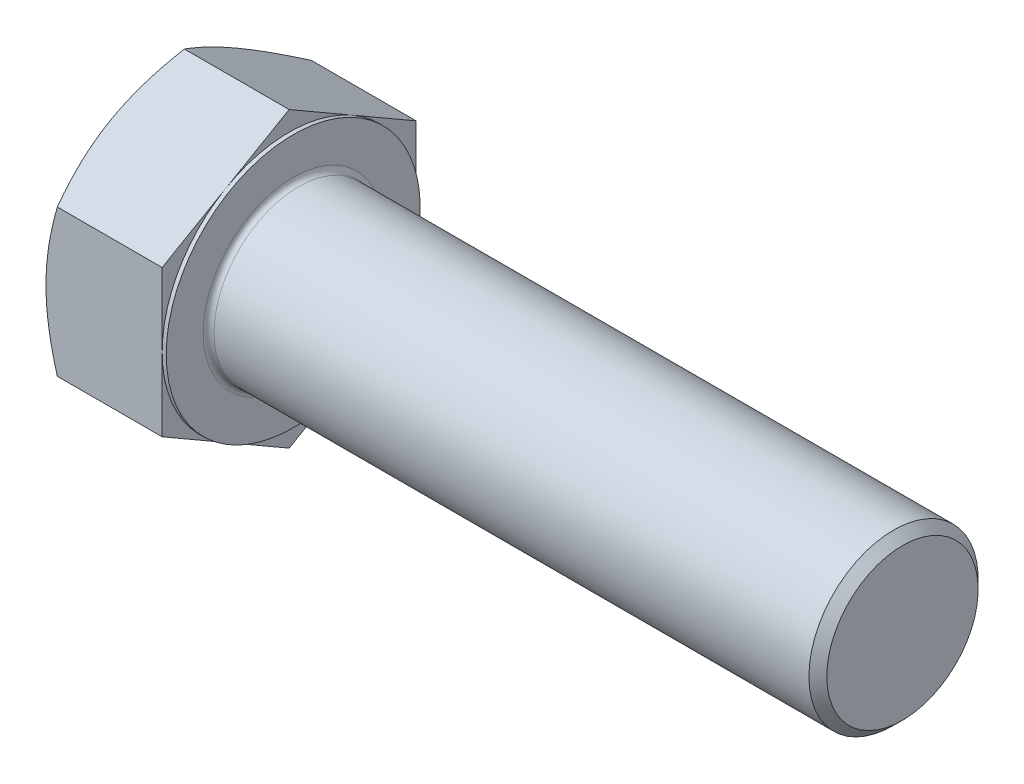
from build123d import *

# Parameters (mm, degrees)
BASEHEAD_DEPTH = 11.2776
SKETCH4_W      = 0.381
SKETCH4_H      = 27.242885633
HEADFILLET_R   = 0.508


with BuildPart() as part:
    # Sketch1 → BaseHead (new body)
    with BuildSketch(Plane(origin=(0, 0, 0), x_dir=(0, 0, -1), z_dir=(1, 0, 0))):
        Polygon((11.9126, 6.877742817), (11.9126, -6.877742817), (0, -13.755485633), (-11.9126, -6.877742817), (-11.9126, 6.877742817), (0, 13.755485633), align=None)
    extrude(amount=BASEHEAD_DEPTH)

    # BodySke → BaseBody (revolve)
    with BuildSketch(Plane.XY):
        Polygon((0, 0), (68.4276, 0), (68.4276, 7.09803), (67.58813, 7.9375), (0, 7.9375), align=None)
    revolve(axis=Axis((0, 0, 0), (1, 0, 0)))

    # Sketch3 → HeadChamfer (revolve, cut)
    with BuildSketch(Plane.XY):
        Polygon((0, 11.9126), (4.730164726, 20.105485633), (4.730164726, 26.455485633), (-12.7, 26.455485633), (-12.7, 11.9126), align=None)
    revolve(axis=Axis((0, 0, 0), (1, 0, 0)), mode=Mode.SUBTRACT)

    # Sketch4 → BearingFace (revolve, cut)
    with BuildSketch(Plane.XY):
        with Locations((11.0871, 25.534042817)):
            Rectangle(SKETCH4_W, SKETCH4_H)
    revolve(axis=Axis((0, 0, 0), (1, 0, 0)), mode=Mode.SUBTRACT)

    # HeadFillet
    headfillet_edges = [part.edges().sort_by_distance(p)[0] for p in [
        (11.2776, -7.9375, 0),
    ]]
    fillet(headfillet_edges, radius=HEADFILLET_R)


solid = part.part
